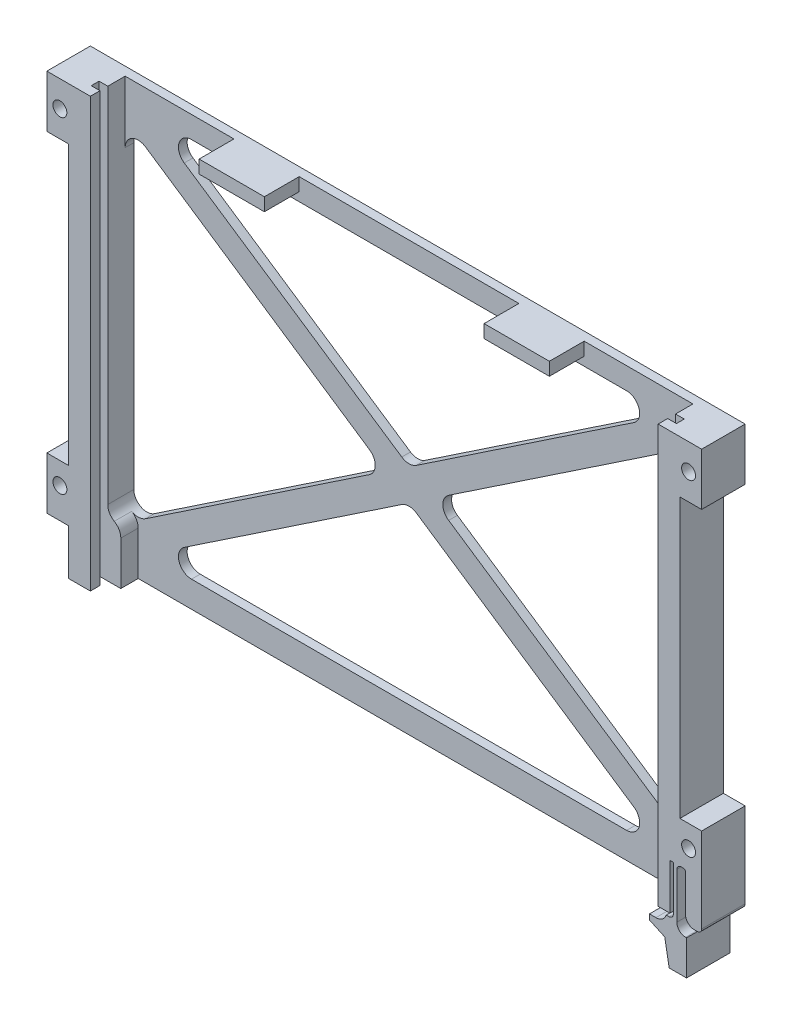
from build123d import *

# Parameters (mm, degrees)
BOSS_EXTRUDE1_DEPTH     = 10
SKETCH3_W               = 134.5
SKETCH3_H               = 1.8
CUT_EXTRUDE1_DEPTH      = 170.435828561
SKETCH5_W               = 140.5
SKETCH5_H               = 6
BOSS_EXTRUDE3_DEPTH     = 2
CUT_EXTRUDE2_DEPTH      = 170.435828561
FILLET1_R               = 3
BOSS_EXTRUDE2_OUTLINE_W = 5
BOSS_EXTRUDE2_OUTLINE_H = 12
BOSS_EXTRUDE2_OUTLINE_R = 1.6
BOSS_EXTRUDE2_DEPTH     = 10
SKETCH7_W               = 130.5
SKETCH7_H               = 5
CUT_EXTRUDE3_DEPTH      = 8
SKETCH8_W               = 15
SKETCH8_H               = 3
BOSS_EXTRUDE4_DEPTH     = 8
BOSS_EXTRUDE5_DEPTH     = 4
FILLET2_R               = 3


# Read off the part's stored shape, not the designer's step: Boss-Extrude2
with BuildPart() as part:
    # Sketch2 → Boss-Extrude1 (new body)
    with BuildSketch(Plane.XY):
        Polygon((2, 0), (-3, 0), (-3, 98.5), (137.5, 98.5), (137.5, 0), (132.5, 0), (132.5, 93.5), (2, 93.5), align=None)
    extrude(amount=BOSS_EXTRUDE1_DEPTH)

    # Sketch3 → Cut-Extrude1 (cut, through all)
    with BuildSketch(Plane.XZ):
        with Locations((67.25, 6.9)):
            Rectangle(SKETCH3_W, SKETCH3_H)
    extrude(amount=-CUT_EXTRUDE1_DEPTH, mode=Mode.SUBTRACT)

    # Sketch5 → Boss-Extrude3 (add)
    with BuildSketch(Plane(origin=(0, 0, 0), x_dir=(-1, 0, 0), z_dir=(0, 0, -1))):
        with Locations((-67.25, 3)):
            Rectangle(SKETCH5_W, SKETCH5_H)
        Polygon((-0.329295866, 8.49173588), (-130.829295866, 95.99173588), (-134.170704134, 91.00826412), (-3.670704134, 3.50826412), align=None)
        Polygon((-3.670704134, 95.99173588), (-134.170704134, 8.49173588), (-130.829295866, 3.50826412), (-0.329295866, 91.00826412), align=None)
    extrude(amount=-BOSS_EXTRUDE3_DEPTH)

    # Sketch4 → Cut-Extrude2 (cut, through all)
    with BuildSketch(Plane.XY):
        with BuildLine():
            ThreePointArc((132, 0), (133.457737974, 0.468990399), (134.368543856, 1.7))
            Line((134.368543856, 1.7), (135, 1.7))
            ThreePointArc((135, 1.7), (135.707106781, 1.992893219), (136, 2.7))
            Line((136, 2.7), (136, 13))
            Line((136, 13), (135.2, 13))
            Line((135.2, 13), (135.2, 2.5))
            Line((135.2, 2.5), (129.5, 2.5))
            Line((129.5, 2.5), (129.5, 0))
            Line((129.5, 0), (130.5, 0))
            Line((130.5, 0), (132, 0))
        make_face()
        with BuildLine():
            ThreePointArc((141.5, 2), (142.207106781, 2.292893219), (142.5, 3))
            Line((142.5, 3), (142.5, -0.5))
            Line((142.5, -0.5), (139.0272352, -0.5))
            Line((139.0272352, -0.5), (138.8, -0.5))
            ThreePointArc((138.8, -0.5), (137.385786438, 0.085786438), (136.8, 1.5))
            Line((136.8, 1.5), (136.8, 12))
            ThreePointArc((136.8, 12), (137.092893219, 12.707106781), (137.8, 13))
            Line((137.8, 13), (138.3, 13))
            ThreePointArc((138.3, 13), (138.653553391, 12.853553391), (138.8, 12.5))
            Line((138.8, 12.5), (138.8, 4))
            ThreePointArc((138.8, 4), (139.385786438, 2.585786438), (140.8, 2))
            Line((140.8, 2), (141.5, 2))
        make_face()
    extrude(amount=CUT_EXTRUDE2_DEPTH, mode=Mode.SUBTRACT)

    # Fillet1
    fillet1_edges = [part.edges().sort_by_distance(p)[0] for p in [
        (132.5, 89.888060199, 1),
        (72.636950218, 49.75, 1),
        (61.863049782, 49.75, 1),
        (67.25, 53.361939801, 1),
        (2, 89.888060199, 1),
        (127.113049782, 93.5, 1),
        (7.386950218, 6, 1),
        (2, 9.611939801, 1),
        (132.5, 9.611939801, 1),
        (67.25, 46.138060199, 1),
        (127.113049782, 6, 1),
        (7.386950218, 93.5, 1),
    ]]
    fillet(fillet1_edges, radius=FILLET1_R)

    # Boss-Extrude2 outline → Boss-Extrude2 (add)
    # profile 1 of 5: a face of its own
    with BuildSketch(Plane.XY):
        with BuildLine():
            Line((134.5, 1.7), (134.368543856, 1.7))
            ThreePointArc((134.368543856, 1.7), (133.457737974, 0.468990399), (132, 0))
            Line((132, 0), (130.5, 0))
            Line((130.5, 0), (130.5, -1.2))
            Line((130.5, -1.2), (134.0272352, -2.83697044))
            Line((134.0272352, -2.83697044), (135.0272352, -8.5))
            Line((135.0272352, -8.5), (139.0272352, -8.5))
            Line((139.0272352, -8.5), (139.0272352, -0.5))
            Line((139.0272352, -0.5), (138.8, -0.5))
            ThreePointArc((138.8, -0.5), (138.092893219, -0.370828693), (137.477124345, 1e-09))
            Line((137.477124345, 1e-09), (134.5, 0))
            Line((134.5, 0), (134.5, 1.7))
        make_face()
    # profile 2 of 5: a face of its own
    with BuildSketch(Plane.XY):
        with Locations((-5.5, 16.5)):
            Rectangle(BOSS_EXTRUDE2_OUTLINE_W, BOSS_EXTRUDE2_OUTLINE_H)
        with Locations((-5, 17.5)):
            Circle(BOSS_EXTRUDE2_OUTLINE_R, mode=Mode.SUBTRACT)
    # profile 3 of 5: a face of its own
    with BuildSketch(Plane.XY):
        with Locations((-5.5, 92.5)):
            Rectangle(BOSS_EXTRUDE2_OUTLINE_W, BOSS_EXTRUDE2_OUTLINE_H)
        with Locations((-5, 92.5)):
            Circle(BOSS_EXTRUDE2_OUTLINE_R, mode=Mode.SUBTRACT)
    # profile 4 of 5: a face of its own
    with BuildSketch(Plane.XY):
        with Locations((140, 92.5)):
            Rectangle(BOSS_EXTRUDE2_OUTLINE_W, BOSS_EXTRUDE2_OUTLINE_H)
        with Locations((139.5, 92.5)):
            Circle(BOSS_EXTRUDE2_OUTLINE_R, mode=Mode.SUBTRACT)
    # profile 5 of 5: a face of its own
    with BuildSketch(Plane.XY):
        with BuildLine():
            Line((137.8, 13), (138.3, 13))
            ThreePointArc((138.3, 13), (138.653553391, 12.853553391), (138.8, 12.5))
            Line((138.8, 12.5), (138.8, 4))
            ThreePointArc((138.8, 4), (139.385786438, 2.585786438), (140.8, 2))
            Line((140.8, 2), (141.5, 2))
            ThreePointArc((141.5, 2), (142.207106781, 2.292893219), (142.5, 3))
            Line((142.5, 3), (142.5, 22.5))
            Line((142.5, 22.5), (137.5, 22.5))
            Line((137.5, 22.5), (137.5, 12.953939201))
            ThreePointArc((137.5, 12.953939201), (137.648242301, 12.988417726), (137.8, 13))
        make_face()
        with Locations((139.5, 17.5)):
            Circle(BOSS_EXTRUDE2_OUTLINE_R, mode=Mode.SUBTRACT)
    extrude(amount=BOSS_EXTRUDE2_DEPTH)

    # Sketch7 → Cut-Extrude3 (cut)
    with BuildSketch(Plane.XY.offset(10)):
        with Locations((67.25, 96)):
            Rectangle(SKETCH7_W, SKETCH7_H)
    extrude(amount=-CUT_EXTRUDE3_DEPTH, mode=Mode.SUBTRACT)

    # Sketch8 → Boss-Extrude4 (add)
    with BuildSketch(Plane.XY.offset(2)):
        with Locations((34.5, 97)):
            Rectangle(SKETCH8_W, SKETCH8_H)
        with Locations((100, 97)):
            Rectangle(SKETCH8_W, SKETCH8_H)
    extrude(amount=BOSS_EXTRUDE4_DEPTH)

    # Sketch9 → Boss-Extrude5 (add)
    with BuildSketch(Plane.XY.offset(2)):
        with BuildLine():
            ThreePointArc((132.5, 15.235373856), (131.621320344, 13.114053512), (129.5, 12.235373856))
            Line((129.5, 12.235373856), (129.5, 2.5))
            Line((129.5, 2.5), (132.5, 2.5))
            Line((132.5, 2.5), (132.5, 15.235373856))
        make_face()
        with BuildLine():
            Line((2, 0), (5, 0))
            Line((5, 0), (5, 12.235373856))
            ThreePointArc((5, 12.235373856), (2.878679656, 13.114053512), (2, 15.235373856))
            Line((2, 15.235373856), (2, 0))
        make_face()
    extrude(amount=BOSS_EXTRUDE5_DEPTH)

    # Fillet2
    fillet2_edges = [part.edges().sort_by_distance(p)[0] for p in [
        (5, 12.235373856, 4),
        (129.5, 12.235373856, 4),
    ]]
    fillet(fillet2_edges, radius=FILLET2_R)


solid = part.part
